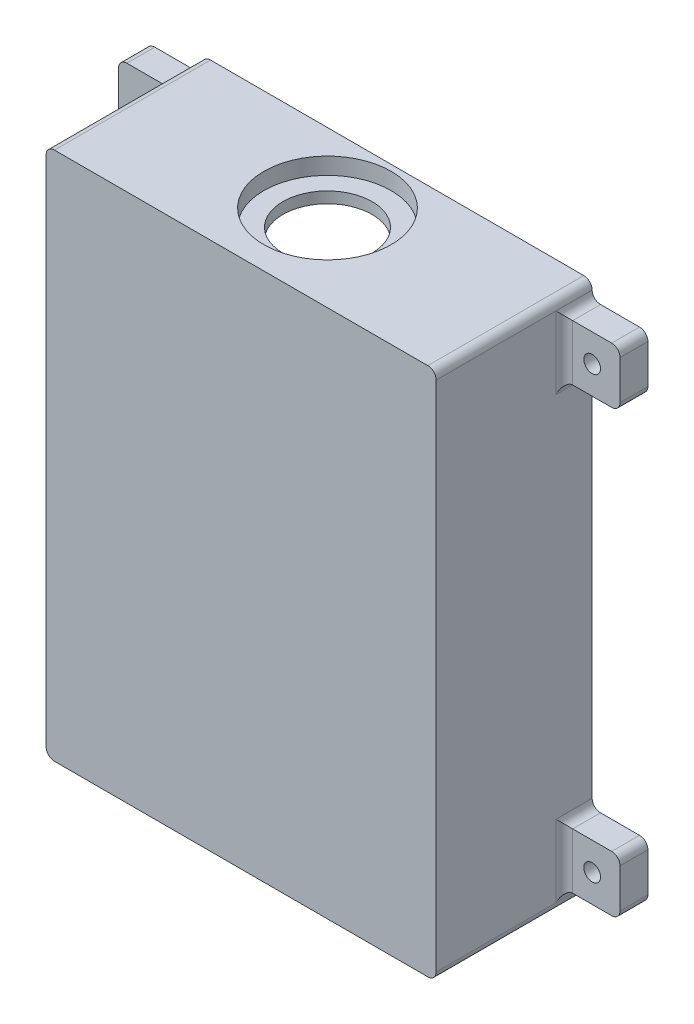
from build123d import *

# Parameters (mm, degrees)
SKETCH1_W            = 70
SKETCH1_H            = 95
BASE_DEPTH           = 28
SKETCH1_7_W          = 10
SKETCH1_7_H          = 10
SKETCH1_7_R          = 1.5
MOUNTING_HOLES_DEPTH = 5
SKETCH1_6_W          = 60
SKETCH1_6_H          = 85
SKETCH1_6_R          = 2.85
SKETCH1_6_R_2        = 1.85
CAVITY_DEPTH         = 25
STANDOFF_START       = 25
SKETCH1_9_R          = 2.85
SKETCH1_9_R_2        = 1.85
STANDOFF_DEPTH       = 3
PG9_DEPTH            = 5
SKETCH3_3_R          = 11.414954575
SKETCH3_3_R_2        = 8
CUT_EXTRUDE4_DEPTH   = 3
EXTERNAL_FILLET_R    = 1.5


with BuildPart() as part:
    # Sketch1 → Base (new body)
    with BuildSketch(Plane.XY):
        Rectangle(SKETCH1_W, SKETCH1_H)
    extrude(amount=BASE_DEPTH)

    # Sketch1<7> → Mounting Holes (add)
    # profile 1 of 4: a face of its own
    with BuildSketch(Plane.XY):
        with Locations((40, 39.5)):
            Rectangle(SKETCH1_7_W, SKETCH1_7_H)
        with Locations((40, 39.5)):
            Circle(SKETCH1_7_R, mode=Mode.SUBTRACT)
    # profile 2 of 4: a face of its own
    with BuildSketch(Plane.XY):
        with Locations((40, -39.5)):
            Rectangle(SKETCH1_7_W, SKETCH1_7_H)
        with Locations((40, -39.5)):
            Circle(SKETCH1_7_R, mode=Mode.SUBTRACT)
    # profile 3 of 4: a face of its own
    with BuildSketch(Plane.XY):
        with Locations((-40, -39.5)):
            Rectangle(SKETCH1_7_W, SKETCH1_7_H)
        with Locations((-40, -39.5)):
            Circle(SKETCH1_7_R, mode=Mode.SUBTRACT)
    # profile 4 of 4: a face of its own
    with BuildSketch(Plane.XY):
        with Locations((-40, 39.5)):
            Rectangle(SKETCH1_7_W, SKETCH1_7_H)
        with Locations((-40, 39.5)):
            Circle(SKETCH1_7_R, mode=Mode.SUBTRACT)
    extrude(amount=MOUNTING_HOLES_DEPTH)

    # Sketch1<6> → Cavity (cut)
    # profile 1 of 5: a face of its own
    with BuildSketch(Plane.XY):
        Rectangle(SKETCH1_6_W, SKETCH1_6_H)
        with Locations((0.70771822, -25.5)):
            Circle(SKETCH1_6_R, mode=Mode.SUBTRACT)
        with Locations((0.70771822, 27.586)):
            Circle(SKETCH1_6_R, mode=Mode.SUBTRACT)
    # profile 2 of 5: a face of its own
    with BuildSketch(Plane.XY):
        with Locations((0.70771822, 27.586)):
            Circle(SKETCH1_6_R)
        with Locations((0.70771822, 27.586)):
            Circle(SKETCH1_6_R_2, mode=Mode.SUBTRACT)
    # profile 3 of 5: a face of its own
    with BuildSketch(Plane.XY):
        with Locations((0.70771822, 27.586)):
            Circle(SKETCH1_6_R_2)
    # profile 4 of 5: a face of its own
    with BuildSketch(Plane.XY):
        with Locations((0.70771822, -25.5)):
            Circle(SKETCH1_6_R)
        with Locations((0.70771822, -25.5)):
            Circle(SKETCH1_6_R_2, mode=Mode.SUBTRACT)
    # profile 5 of 5: a face of its own
    with BuildSketch(Plane.XY):
        with Locations((0.70771822, -25.5)):
            Circle(SKETCH1_6_R_2)
    extrude(amount=CAVITY_DEPTH, mode=Mode.SUBTRACT)

    # Sketch1<9> → Standoff (add)
    # profile 1 of 2: a face of its own
    with BuildSketch(Plane.XY.offset(STANDOFF_START)):
        with Locations((0.70771822, 27.586)):
            Circle(SKETCH1_9_R)
        with Locations((0.70771822, 27.586)):
            Circle(SKETCH1_9_R_2, mode=Mode.SUBTRACT)
    # profile 2 of 2: a face of its own
    with BuildSketch(Plane.XY.offset(STANDOFF_START)):
        with Locations((0.70771822, -25.5)):
            Circle(SKETCH1_9_R)
        with Locations((0.70771822, -25.5)):
            Circle(SKETCH1_9_R_2, mode=Mode.SUBTRACT)
    extrude(amount=-STANDOFF_DEPTH)

    # Sketch3 → PG9 (cut)
    with BuildSketch(Plane(origin=(7.707718219, 47.5, 0), x_dir=(0, 0, 1), z_dir=(0, -1, 0))):
        with BuildLine():
            ThreePointArc((4.5, 7.707718219), (12.5, -0.292281781), (20.5, 7.707718219))
            Line((20.5, 7.707718219), (4.5, 7.707718219))
        make_face()
        with BuildLine():
            Line((4.5, 7.707718219), (20.5, 7.707718219))
            ThreePointArc((20.5, 7.707718219), (12.5, 15.707718219), (4.5, 7.707718219))
        make_face()
    extrude(amount=PG9_DEPTH, mode=Mode.SUBTRACT)

    # Sketch3<3> → Cut-Extrude4 (cut)
    with BuildSketch(Plane(origin=(7.707718219, 47.5, 0), x_dir=(0, 0, 1), z_dir=(0, -1, 0))):
        with Locations(Location((12.5, 7.707718219, 0), (0, 0, 90))):
            Circle(SKETCH3_3_R)
        with Locations((12.5, 7.707718219)):
            Circle(SKETCH3_3_R_2, mode=Mode.SUBTRACT)
    extrude(amount=CUT_EXTRUDE4_DEPTH, mode=Mode.SUBTRACT)

    # External Fillet
    external_fillet_edges = [part.edges().sort_by_distance(p)[0] for p in [
        (45, 34.5, 2.5),
        (45, 44.5, 2.5),
        (35, 39.5, 5),
        (35, 44.5, 2.5),
        (35, 34.5, 2.5),
        (45, -34.5, 2.5),
        (35, -39.5, 5),
        (35, -34.5, 2.5),
        (35, -44.5, 2.5),
        (45, -44.5, 2.5),
        (-45, -34.5, 2.5),
        (-45, -44.5, 2.5),
        (-35, -44.5, 2.5),
        (-35, -34.5, 2.5),
        (-35, -39.5, 5),
        (-35, 34.5, 2.5),
        (-35, 44.5, 2.5),
        (-45, 44.5, 2.5),
        (-45, 34.5, 2.5),
        (-35, 39.5, 5),
        (-35, -47.5, 14),
        (-35, 47.5, 14),
        (35, 47.5, 14),
        (35, -47.5, 14),
    ]]
    fillet(external_fillet_edges, radius=EXTERNAL_FILLET_R - 0.0001)  # a hair under: the kernel refuses the full size


solid = part.part
